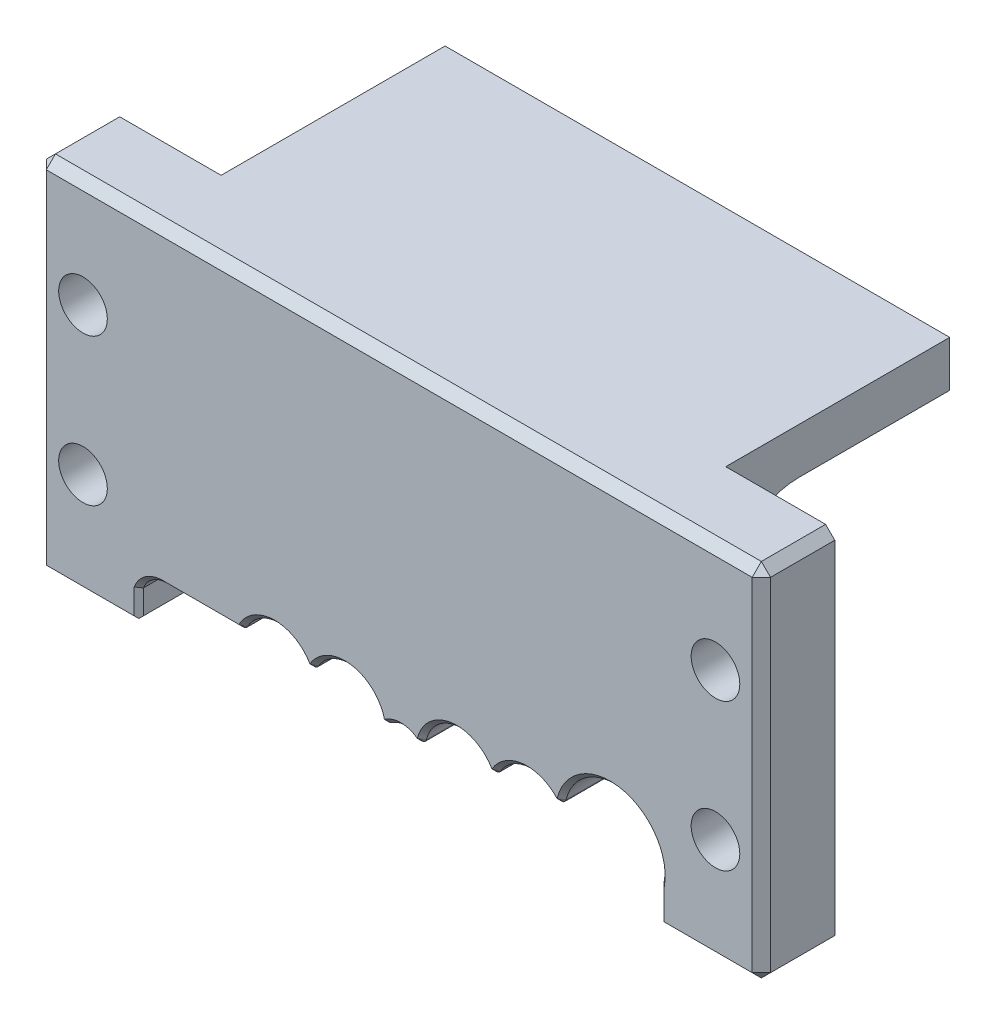
from build123d import *

# Parameters (mm, degrees)
SKETCH4_W           = 78.9
SKETCH4_H           = 39.3
BOSS_EXTRUDE2_DEPTH = 8
CUT_EXTRUDE2_REACH  = 58.315
CUT_EXTRUDE3_REACH  = 58.315
SKETCH7_R           = 2.65
CHAMFER3_SIZE       = 1
CHAMFER4_SIZE       = 0.5
SKETCH8_W           = 54.974490404
SKETCH8_H           = 5
BOSS_EXTRUDE3_DEPTH = 24.4
FILLET1_R           = 8


with BuildPart() as part:
    # Sketch4 → Boss-Extrude2 (new body)
    with BuildSketch(Plane.XY):
        with Locations((-0.082754798, -19.65)):
            Rectangle(SKETCH4_W, SKETCH4_H)
    extrude(amount=BOSS_EXTRUDE2_DEPTH)

    # Sketch6 → Cut-Extrude2 (cut, up to next)
    with BuildSketch(Plane.XY.offset(8), mode=Mode.PRIVATE) as cut_extrude2_sk1:
        with BuildLine():
            Line((28.287245202, -39.5), (28.287245202, -34.966633333))
            ThreePointArc((28.287245202, -34.966633333), (24.090185885, -28.57821772), (17.597136747, -32.611513376))
            ThreePointArc((17.597136747, -32.611513376), (17.234869858, -32.976161871), (16.742475109, -32.828672095))
            ThreePointArc((16.742475109, -32.828672095), (13.426365224, -31.57225608), (10.450959192, -33.501537013))
            ThreePointArc((10.450959192, -33.501537013), (10.018755802, -33.750140454), (9.586552412, -33.501537013))
            ThreePointArc((9.586552412, -33.501537013), (5.626846324, -31.591156717), (2.378419018, -34.553680172))
            ThreePointArc((2.378419018, -34.553680172), (2.064006845, -34.905939189), (1.596551631, -34.839403086))
            ThreePointArc((1.596551631, -34.839403086), (0.102573651, -34.35), (-1.39140433, -34.839403086))
            ThreePointArc((-1.39140433, -34.839403086), (-1.858859544, -34.905939189), (-2.173271717, -34.553680172))
            ThreePointArc((-2.173271717, -34.553680172), (-5.421699023, -31.591156717), (-9.381405111, -33.501537013))
            ThreePointArc((-9.381405111, -33.501537013), (-9.813608501, -33.750140454), (-10.245811891, -33.501537013))
            ThreePointArc((-10.245811891, -33.501537013), (-13.71465449, -31.550736756), (-17.105314368, -33.634463277))
            ThreePointArc((-17.105314368, -33.634463277), (-17.289281672, -33.828504165), (-17.54693295, -33.9))
            Line((-17.54693295, -33.9), (-25.852754798, -33.9))
            ThreePointArc((-25.852754798, -33.9), (-27.422811269, -34.381612052), (-28.452754798, -35.660769515))
            Line((-28.452754798, -35.660769515), (-28.452754798, -39.5))
            Line((-28.452754798, -39.5), (28.287245202, -39.5))
        make_face()
    cut_extrude2_tool1 = extrude(cut_extrude2_sk1.sketch, amount=-CUT_EXTRUDE2_REACH, mode=Mode.PRIVATE) & part.part
    add(cut_extrude2_tool1.solids().sort_by_distance((2.671043, -35.689379, 8))[0], mode=Mode.SUBTRACT)

    # Sketch7 → Cut-Extrude3 (cut, up to next)
    with BuildSketch(Plane.XY.offset(8), mode=Mode.PRIVATE) as cut_extrude3_sk1:
        with Locations((-34.532754798, -11.75)):
            Circle(SKETCH7_R)
    cut_extrude3_tool1 = extrude(cut_extrude3_sk1.sketch, amount=-CUT_EXTRUDE3_REACH, mode=Mode.PRIVATE) & part.part
    # Sketch7 → Cut-Extrude3 (cut, up to next)
    with BuildSketch(Plane.XY.offset(8), mode=Mode.PRIVATE) as cut_extrude3_sk2:
        with Locations((-34.532754798, -27.75)):
            Circle(SKETCH7_R)
    cut_extrude3_tool2 = extrude(cut_extrude3_sk2.sketch, amount=-CUT_EXTRUDE3_REACH, mode=Mode.PRIVATE) & part.part
    # Sketch7 → Cut-Extrude3 (cut, up to next)
    with BuildSketch(Plane.XY.offset(8), mode=Mode.PRIVATE) as cut_extrude3_sk3:
        with Locations((34.367245202, -11.75)):
            Circle(SKETCH7_R)
    cut_extrude3_tool3 = extrude(cut_extrude3_sk3.sketch, amount=-CUT_EXTRUDE3_REACH, mode=Mode.PRIVATE) & part.part
    # Sketch7 → Cut-Extrude3 (cut, up to next)
    with BuildSketch(Plane.XY.offset(8), mode=Mode.PRIVATE) as cut_extrude3_sk4:
        with Locations((34.367245202, -27.75)):
            Circle(SKETCH7_R)
    cut_extrude3_tool4 = extrude(cut_extrude3_sk4.sketch, amount=-CUT_EXTRUDE3_REACH, mode=Mode.PRIVATE) & part.part
    add(cut_extrude3_tool1.solids().sort_by_distance((-34.532755, -11.75, 8))[0], mode=Mode.SUBTRACT)
    add(cut_extrude3_tool2.solids().sort_by_distance((-34.532755, -27.75, 8))[0], mode=Mode.SUBTRACT)
    add(cut_extrude3_tool3.solids().sort_by_distance((34.367245, -11.75, 8))[0], mode=Mode.SUBTRACT)
    add(cut_extrude3_tool4.solids().sort_by_distance((34.367245, -27.75, 8))[0], mode=Mode.SUBTRACT)

    # Chamfer3
    chamfer3_edges = [part.edges().sort_by_distance(p)[0] for p in [
        (-0.082754798, 0, 8),
        (-39.532754798, -19.65, 8),
        (33.827245202, -39.3, 8),
        (-28.452754798, -39.3, 4),
        (28.287245202, -39.3, 4),
        (-33.992754798, -39.3, 8),
        (39.367245202, -19.65, 8),
        (-39.532754798, -39.3, 4),
        (-39.532754798, 0, 4),
        (39.367245202, 0, 4),
        (39.367245202, -39.3, 4),
    ]]
    chamfer(chamfer3_edges, length=CHAMFER3_SIZE)

    # Chamfer4
    chamfer4_edges = [part.edges().sort_by_distance(p)[0] for p in [
        (-27.422811269, -34.381612052, 0),
        (-21.699843874, -33.9, 0),
        (-17.289281672, -33.828504165, 0),
        (-13.71465449, -31.550736756, 0),
        (-9.813608501, -33.750140454, 0),
        (-5.421699023, -31.591156717, 0),
        (-1.858859544, -34.905939189, 0),
        (0.102573651, -34.35, 0),
        (2.064006845, -34.905939189, 0),
        (24.090185885, -28.57821772, 0),
        (5.626846324, -31.591156717, 0),
        (17.234869858, -32.976161871, 0),
        (10.018755802, -33.750140454, 0),
        (13.426365224, -31.57225608, 0),
    ]]
    chamfer(chamfer4_edges, length=CHAMFER4_SIZE - 0.0001)  # a hair under: the kernel refuses the full size
    chamfer4_2_edges = [part.edges().sort_by_distance(p)[0] for p in [
        (28.287245202, -37.41718435, 0),
    ]]
    chamfer(chamfer4_2_edges, length=CHAMFER4_SIZE)
    chamfer4_3_edges = [part.edges().sort_by_distance(p)[0] for p in [
        (-27.422811269, -34.381612052, 8),
        (-21.699843874, -33.9, 8),
        (-17.289281672, -33.828504165, 8),
        (-13.71465449, -31.550736756, 8),
        (-9.813608501, -33.750140454, 8),
        (-5.421699023, -31.591156717, 8),
        (-1.858859544, -34.905939189, 8),
        (0.102573651, -34.35, 8),
        (2.064006845, -34.905939189, 8),
        (24.090185885, -28.57821772, 8),
        (5.626846324, -31.591156717, 8),
        (17.234869858, -32.976161871, 8),
        (10.018755802, -33.750140454, 8),
        (13.426365224, -31.57225608, 8),
    ]]
    chamfer(chamfer4_3_edges, length=CHAMFER4_SIZE - 0.0001)  # a hair under: the kernel refuses the full size
    chamfer4_4_edges = [part.edges().sort_by_distance(p)[0] for p in [
        (28.287245202, -37.41718435, 8),
    ]]
    chamfer(chamfer4_4_edges, length=CHAMFER4_SIZE)
    chamfer4_5_edges = [part.edges().sort_by_distance(p)[0] for p in [
        (-28.452754798, -36.980384758, 0),
    ]]
    chamfer(chamfer4_5_edges, length=CHAMFER4_SIZE - 0.0001)  # a hair under: the kernel refuses the full size
    chamfer4_6_edges = [part.edges().sort_by_distance(p)[0] for p in [
        (-28.452754798, -36.980384758, 8),
    ]]
    chamfer(chamfer4_6_edges, length=CHAMFER4_SIZE - 0.0001)  # a hair under: the kernel refuses the full size

    # Sketch8 → Boss-Extrude3 (add)
    with BuildSketch(Plane(origin=(0, 0, 0), x_dir=(-1, 0, 0), z_dir=(0, 0, -1))):
        with Locations((0, -2.5)):
            Rectangle(SKETCH8_W, SKETCH8_H)
    extrude(amount=BOSS_EXTRUDE3_DEPTH)

    # Fillet1
    fillet1_edges = [part.edges().sort_by_distance(p)[0] for p in [
        (0, -5, 0),
    ]]
    fillet(fillet1_edges, radius=FILLET1_R)


solid = part.part
